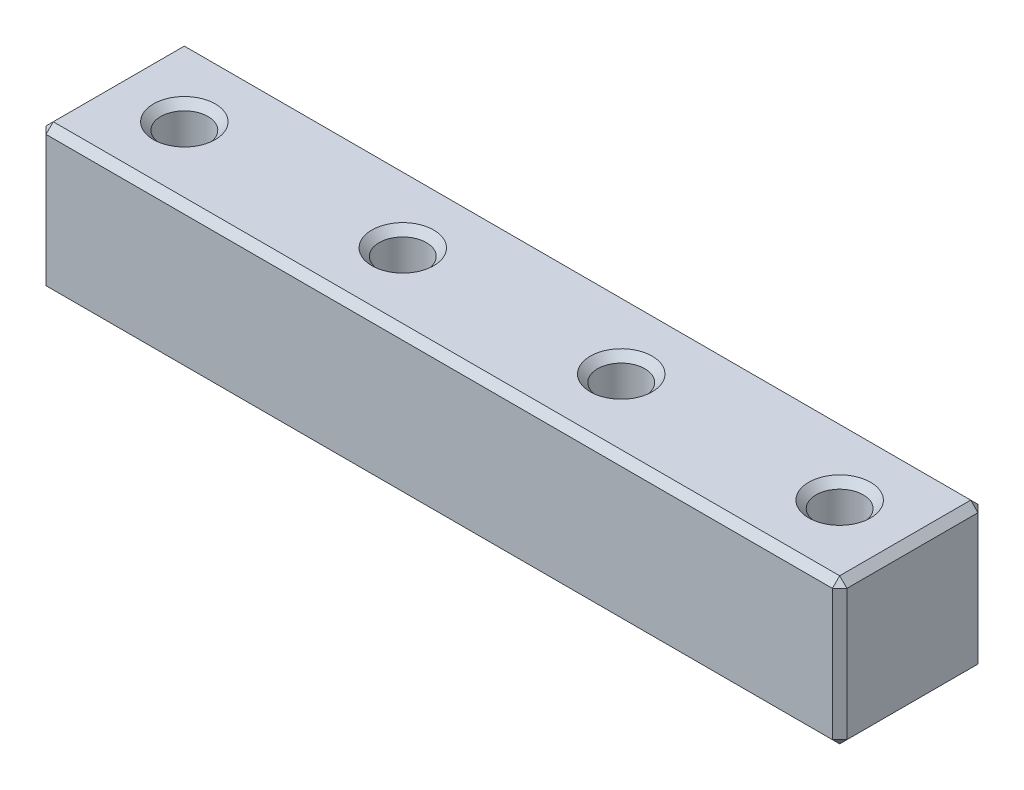
from build123d import *

# Parameters (mm, degrees)
SKETCH1_W           = 110
SKETCH1_H           = 20
SKETCH1_R           = 3.25
BOSS_EXTRUDE1_DEPTH = 20
CHAMFER1_SIZE       = 1


with BuildPart() as part:
    # Sketch1 → Boss-Extrude1 (new body)
    with BuildSketch(Plane(origin=(0, 0, 0), x_dir=(1, 0, 0), z_dir=(0, 1, 0))):
        Rectangle(SKETCH1_W, SKETCH1_H)
        with Locations((-45, 0)):
            Circle(SKETCH1_R, mode=Mode.SUBTRACT)
        with Locations((-15, 0)):
            Circle(SKETCH1_R, mode=Mode.SUBTRACT)
        with Locations((15, 0)):
            Circle(SKETCH1_R, mode=Mode.SUBTRACT)
        with Locations((45, 0)):
            Circle(SKETCH1_R, mode=Mode.SUBTRACT)
    extrude(amount=BOSS_EXTRUDE1_DEPTH)

    # Chamfer1
    chamfer1_edges = [part.edges().sort_by_distance(p)[0] for p in [
        (55, 20, 0),
        (55, 0, 0),
        (55, 10, -10),
        (0, 20, -10),
        (0, 0, -10),
        (-55, 10, -10),
        (-55, 20, 0),
        (-55, 0, 0),
        (-55, 10, 10),
        (0, 20, 10),
        (55, 10, 10),
        (0, 0, 10),
        (41.75, 0, 0),
        (41.75, 20, 0),
        (11.75, 0, 0),
        (11.75, 20, 0),
        (-18.25, 0, 0),
        (-18.25, 20, 0),
        (-48.25, 0, 0),
        (-48.25, 20, 0),
    ]]
    chamfer(chamfer1_edges, length=CHAMFER1_SIZE)


solid = part.part
